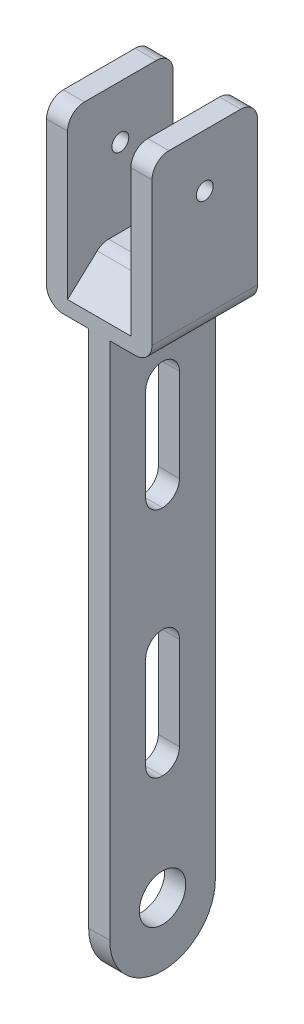
from build123d import *

# Parameters (mm, degrees)
Y_KSEKLIK_EKSTR_ZYON1_DEPTH = 25
IZIM2_R                     = 2
KES_EKSTR_ZYON1_DEPTH       = 25
IZIM3_R                     = 5.5
IZIM3_W                     = 8
IZIM3_H                     = 30
KES_EKSTR_ZYON2_DEPTH       = 10
CUT_EXTRUDE8_DEPTH          = 7.5
RADYUS1_R                   = 4
FILLET1_R                   = 12.5


with BuildPart() as part:
    # Çizim1 → Yükseklik-Ekstrüzyon1 (new body)
    with BuildSketch(Plane.XY):
        Polygon((-2.5, 48), (-12.5, 48), (-12.5, 90), (-7.5, 90), (-7.5, 59), (7.5, 59), (7.5, 90), (12.5, 90), (12.5, 48), (2.5, 48), (2.5, -87.5), (-2.5, -87.5), align=None)
    extrude(amount=Y_KSEKLIK_EKSTR_ZYON1_DEPTH)

    # Çizim2 → Kes-Ekstrüzyon1 (cut)
    with BuildSketch(Plane.ZY.offset(12.5)):
        with Locations((12.5, 77.5)):
            Circle(IZIM2_R)
    extrude(amount=-KES_EKSTR_ZYON1_DEPTH, mode=Mode.SUBTRACT)

    # Çizim3 → Kes-Ekstrüzyon2 (cut)
    with BuildSketch(Plane.ZY.offset(2.5)):
        with Locations((12.5, -72.5)):
            Circle(IZIM3_R)
        with Locations((12.5, 22.5)):
            Rectangle(IZIM3_W, IZIM3_H)
        with Locations((12.5, -32.5)):
            Rectangle(IZIM3_W, IZIM3_H)
    extrude(amount=-KES_EKSTR_ZYON2_DEPTH, mode=Mode.SUBTRACT)

    # Sketch2 → Cut-Extrude8 (cut, symmetric)
    with BuildSketch(Plane(origin=(0, 0, 0), x_dir=(0, 0, -1), z_dir=(1, 0, 0))):
        Polygon((-12.5, 63), (-25.5, 51), (-25.5, 65), (0.5, 65), (0.5, 51), align=None)
    extrude(amount=CUT_EXTRUDE8_DEPTH, both=True, mode=Mode.SUBTRACT)

    # Radyus1
    radyus1_edges = [part.edges().sort_by_distance(p)[0] for p in [
        (-10, 90, 25),
        (10, 90, 25),
        (10, 90, 0),
        (-10, 90, 0),
        (0, 7.5, 16.5),
        (0, 37.5, 16.5),
        (0, 7.5, 8.5),
        (0, 37.5, 8.5),
        (0, -47.5, 16.5),
        (0, -47.5, 8.5),
        (0, -17.5, 16.5),
        (0, -17.5, 8.5),
        (0, 59, 16.833333333),
        (0, 59, 8.166666667),
        (12.5, 48, 12.5),
        (-12.5, 48, 12.5),
    ]]
    fillet(radyus1_edges, radius=RADYUS1_R - 0.0001)  # a hair under: the kernel refuses the full size

    # Fillet1
    fillet1_edges = [part.edges().sort_by_distance(p)[0] for p in [
        (0, -87.5, 0),
        (0, -87.5, 25),
    ]]
    fillet(fillet1_edges, radius=FILLET1_R - 0.0001)  # a hair under: the kernel refuses the full size


solid = part.part
